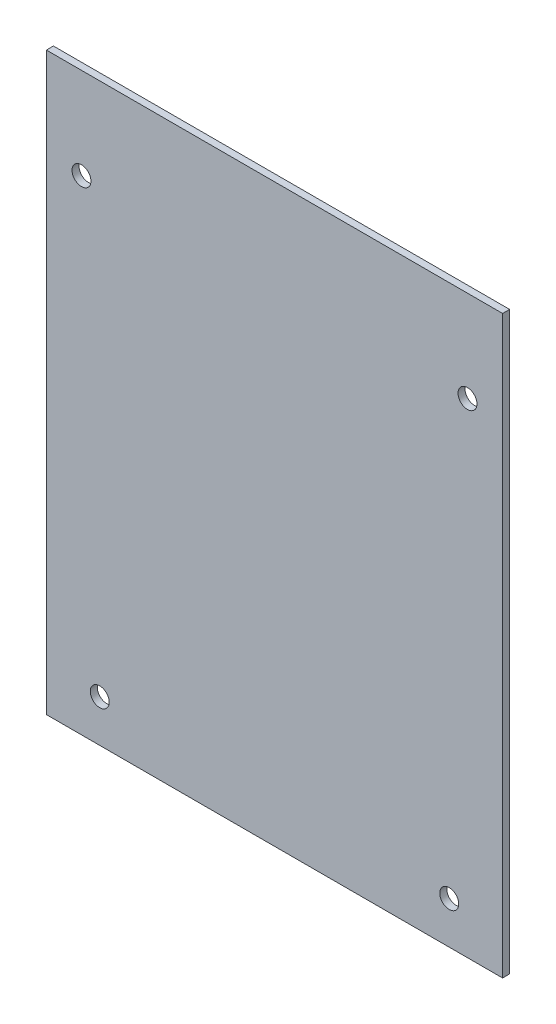
from build123d import *

# Parameters (mm, degrees)
CROQUIS1_W                     = 65
CROQUIS1_H                     = 82
SALIENTE_EXTRUIR1_DEPTH        = 1
TALADRO_DE_MARGEN_PARA_M2_51_D = 2.7


with BuildPart() as part:
    # Croquis1 → Saliente-Extruir1 (new body)
    with BuildSketch(Plane.XY):
        with Locations((32.5, 41)):
            Rectangle(CROQUIS1_W, CROQUIS1_H)
    extrude(amount=SALIENTE_EXTRUIR1_DEPTH)

    # Taladro de margen para M2.51 (through all)
    with Locations(Plane(origin=(5, 69, 1), x_dir=(1, 0, 0), z_dir=(0, 0, 1))):
        with Locations((0, 0), (55, 0), (2.6, -63), (52.4, -63)):
            Hole(TALADRO_DE_MARGEN_PARA_M2_51_D / 2)


solid = part.part
